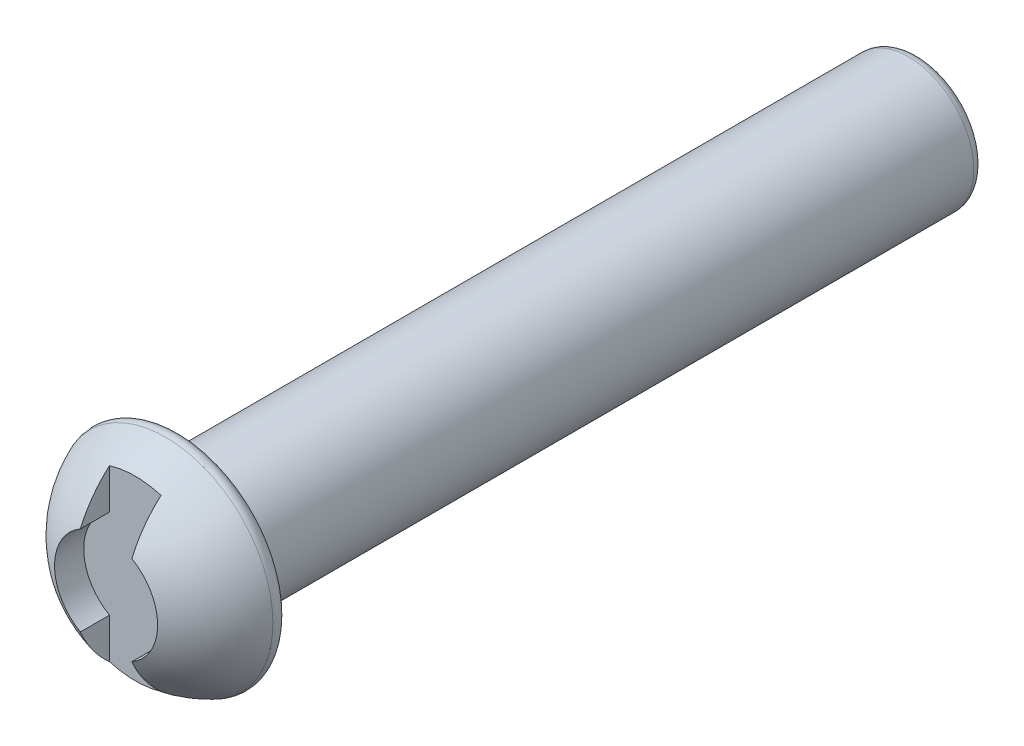
from build123d import *

# Parameters (mm, degrees)
CUT_EXTRUDE1_DEPTH = 0.6
FILLET1_R          = 0.15
FILLET2_R          = 0.15


with BuildPart() as part:
    # Sketch1 → Revolve1 (revolve)
    with BuildSketch(Plane(origin=(0, 0, 0), x_dir=(0, 0, -1), z_dir=(1, 0, 0))):
        with BuildLine():
            Line((0, 0), (12, 0))
            Line((12, 0), (12, 0.95))
            Line((12, 0.95), (1.25, 0.95))
            Line((1.25, 0.95), (1.25, 1.63))
            ThreePointArc((1.25, 1.63), (0.348475184, 1.027058908), (0, 0))
        make_face()
    revolve(axis=Axis((0, 0, 0), (0, 0, -1)))

    # Sketch2 → Cut-Extrude1 (cut)
    with BuildSketch(Plane.XY):
        with BuildLine():
            Line((-0.375, 0.649519053), (-0.375, 1.946416795))
            Line((-0.375, 1.946416795), (0.375, 1.946416795))
            Line((0.375, 1.946416795), (0.375, 0.649519053))
            ThreePointArc((0.375, 0.649519053), (0.75, 0), (0.375, -0.649519053))
            Line((0.375, -0.649519053), (0.375, -1.946416795))
            Line((0.375, -1.946416795), (-0.375, -1.946416795))
            Line((-0.375, -1.946416795), (-0.375, -0.649519053))
            ThreePointArc((-0.375, -0.649519053), (-0.75, 0), (-0.375, 0.649519053))
        make_face()
    extrude(amount=-CUT_EXTRUDE1_DEPTH, mode=Mode.SUBTRACT)

    # Fillet1
    fillet1_edges = [part.edges().sort_by_distance(p)[0] for p in [
        (0, -0.95, -12),
    ]]
    fillet(fillet1_edges, radius=FILLET1_R)

    # Fillet2
    fillet2_edges = [part.edges().sort_by_distance(p)[0] for p in [
        (0, -1.63, -1.25),
    ]]
    fillet(fillet2_edges, radius=FILLET2_R)


solid = part.part
